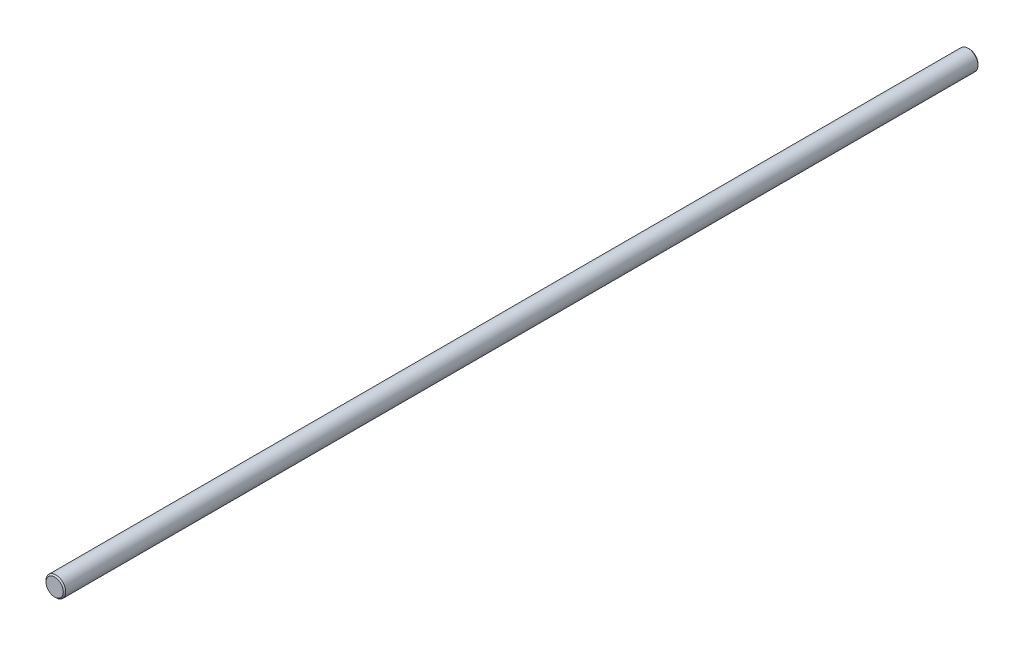
from build123d import *

# Parameters (mm, degrees)
SKETCH1_R           = 4
BOSS_EXTRUDE1_DEPTH = 370
CHAMFER1_SIZE       = 0.5


with BuildPart() as part:
    # Sketch1 → Boss-Extrude1 (new body)
    with BuildSketch(Plane.XY):
        Circle(SKETCH1_R)
    extrude(amount=-BOSS_EXTRUDE1_DEPTH)

    # Chamfer1
    chamfer1_edges = [part.edges().sort_by_distance(p)[0] for p in [
        (-4, 0, -370),
        (-4, 0, 0),
    ]]
    chamfer(chamfer1_edges, length=CHAMFER1_SIZE)


solid = part.part
